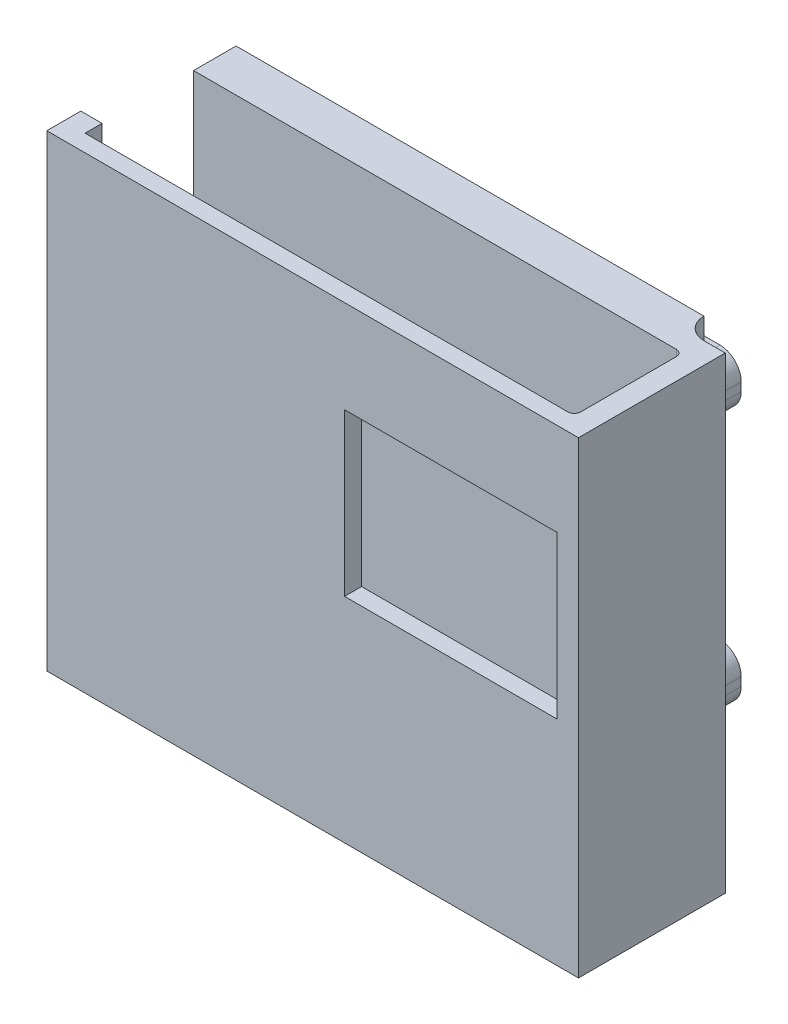
from build123d import *

# Parameters (mm, degrees)
BOSS_EXTRUDE1_DEPTH = 1
FILLET2_R           = 1
SKETCH3_W           = 10
SKETCH3_H           = 7
BOSS_EXTRUDE2_DEPTH = 2
SKETCH4_W           = 22
SKETCH4_H           = 22
BOSS_EXTRUDE3_DEPTH = 2
SKETCH5_W           = 22
SKETCH5_H           = 1
BOSS_EXTRUDE4_DEPTH = 2
SKETCH6_W           = 1
SKETCH6_H           = 22
BOSS_EXTRUDE5_DEPTH = 5.1
FILLET4_R           = 1
FILLET5_R           = 0.3
SKETCH7_W           = 25
SKETCH7_H           = 22
BOSS_EXTRUDE6_DEPTH = 0.8
FILLET6_R           = 0.3
SKETCH8_W           = 10
SKETCH8_H           = 7.6
CUT_EXTRUDE1_DEPTH  = 2
SKETCH9_W           = 1
SKETCH9_H           = 22
BOSS_EXTRUDE7_DEPTH = 0.8


with BuildPart() as part:
    # Sketch2 → Boss-Extrude1 (new body)
    with BuildSketch(Plane(origin=(0, 0, 0), x_dir=(0, 1, 0), z_dir=(0, 0, 1))):
        Polygon((-7.2, 11.5), (-7.2, -11.5), (-4.8, -11.5), (-4.8, -10), (4.8, -10), (4.8, -11.5), (7.2, -11.5), (7.2, 11.5), (4.8, 11.5), (4.8, 6.5), (-4.8, 6.5), (-4.8, 11.5), align=None)
    extrude(amount=BOSS_EXTRUDE1_DEPTH)

    # Fillet2
    fillet2_edges = [part.edges().sort_by_distance(p)[0] for p in [
        (11.5, 7.2, 0.5),
        (11.5, 4.8, 0.5),
        (11.5, -4.8, 0.5),
        (11.5, -7.2, 0.5),
        (-11.5, -7.2, 0.5),
        (-11.5, -4.8, 0.5),
        (-11.5, 4.8, 0.5),
        (-11.5, 7.2, 0.5),
    ]]
    fillet(fillet2_edges, radius=FILLET2_R)

    # Sketch3 → Boss-Extrude2 (add)
    with BuildSketch(Plane.XY.offset(1)):
        with Locations((1.75, 0)):
            Rectangle(SKETCH3_W, SKETCH3_H)
    extrude(amount=BOSS_EXTRUDE2_DEPTH)

    # Sketch4 → Boss-Extrude3 (add)
    with BuildSketch(Plane.XY.offset(3)):
        with Locations((1.75, 0)):
            Rectangle(SKETCH4_W, SKETCH4_H)
    extrude(amount=BOSS_EXTRUDE3_DEPTH)

    # Sketch5 → Boss-Extrude4 (add)
    with BuildSketch(Plane.YZ.offset(12.75)):
        with Locations((0, 4.5)):
            Rectangle(SKETCH5_W, SKETCH5_H)
    extrude(amount=BOSS_EXTRUDE4_DEPTH)

    # Sketch6 → Boss-Extrude5 (add)
    with BuildSketch(Plane.XY.offset(5)):
        with Locations((14.25, 0)):
            Rectangle(SKETCH6_W, SKETCH6_H)
    extrude(amount=BOSS_EXTRUDE5_DEPTH)

    # Fillet4
    fillet4_edges = [part.edges().sort_by_distance(p)[0] for p in [
        (12.75, 0, 4),
    ]]
    fillet(fillet4_edges, radius=FILLET4_R - 0.0001)  # a hair under: the kernel refuses the full size

    # Fillet5
    fillet5_edges = [part.edges().sort_by_distance(p)[0] for p in [
        (13.75, 0, 5),
    ]]
    fillet(fillet5_edges, radius=FILLET5_R)

    # Sketch7 → Boss-Extrude6 (add)
    with BuildSketch(Plane.XY.offset(10.1)):
        with Locations((2.25, 0)):
            Rectangle(SKETCH7_W, SKETCH7_H)
    extrude(amount=BOSS_EXTRUDE6_DEPTH)

    # Fillet6
    fillet6_edges = [part.edges().sort_by_distance(p)[0] for p in [
        (13.75, 0, 10.1),
    ]]
    fillet(fillet6_edges, radius=FILLET6_R)

    # Sketch8 → Cut-Extrude1 (cut)
    with BuildSketch(Plane.XY.offset(10.9)):
        with Locations((8.75, 2.84)):
            Rectangle(SKETCH8_W, SKETCH8_H)
    extrude(amount=-CUT_EXTRUDE1_DEPTH, mode=Mode.SUBTRACT)

    # Sketch9 → Boss-Extrude7 (add)
    with BuildSketch(Plane(origin=(0, 0, 10.1), x_dir=(1, 0, 0), z_dir=(0, 0, -1))):
        with Locations((-9.75, 0)):
            Rectangle(SKETCH9_W, SKETCH9_H)
    extrude(amount=BOSS_EXTRUDE7_DEPTH)


solid = part.part
